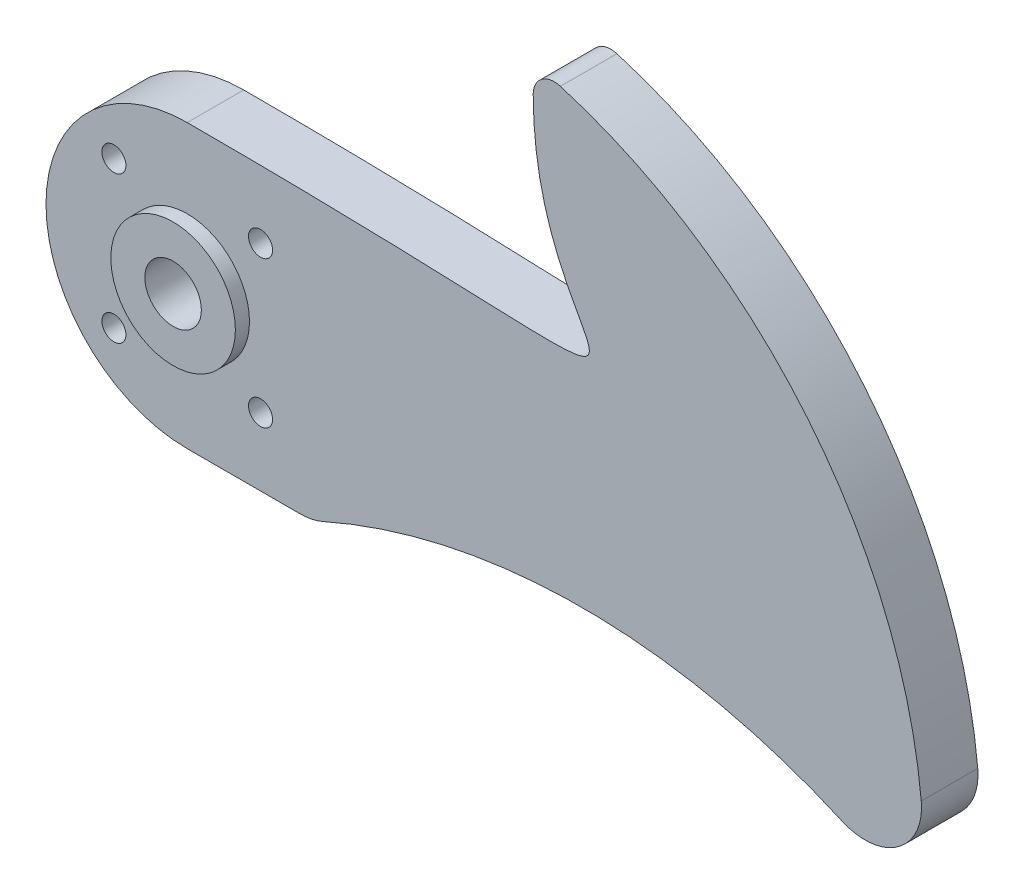
from build123d import *

# Parameters (mm, degrees)
SKETCH1_R             = 3.175
BOSS_EXTRUDE1_DEPTH   = 6.35
F_6_32_TAPPED_HOLE1_D = 2.7051
SKETCH4_R             = 7
SKETCH4_R_2           = 3.175
BOSS_EXTRUDE2_DEPTH   = 1.5875


with BuildPart() as part:
    # Sketch1 → Boss-Extrude1 (new body)
    with BuildSketch(Plane.XY):
        with BuildLine():
            Line((0, -15.875), (12.7, -15.875))
            ThreePointArc((12.7, -15.875), (14.017406742, -15.736838655), (15.277486023, -15.328366764))
            ThreePointArc((15.277486023, -15.328366764), (44.45, -9.14146), (73.622513977, -15.328366764))
            ThreePointArc((73.622513977, -15.328366764), (79.912012711, -14.677034708), (82.52084196, -8.917170323))
            ThreePointArc((82.52084196, -8.917170323), (69.763837113, 21.925102015), (41.955075464, 40.382071192))
            ThreePointArc((41.955075464, 40.382071192), (39.851813107, 40.009159666), (38.89375, 38.1))
            add(Edge.make_bspline(
                [(38.89375, 38.1), (38.89375, 8.240619939), (68.342560944, 15.875), (0, 15.875)],
                knots=[0, 0, 0, 0, 1, 1, 1, 1], degree=3))
            ThreePointArc((0, 15.875), (-15.875, 0), (0, -15.875))
        make_face()
        Circle(SKETCH1_R, mode=Mode.SUBTRACT)
    extrude(amount=BOSS_EXTRUDE1_DEPTH)

    # #6-32 Tapped Hole1 (through all)
    with Locations(Plane.XY.offset(6.35)):
        with Locations((8.242390195, 8.242390195), (-8.242390195, 8.242390195), (8.242390195, -8.242390195), (-8.242390195, -8.242390195)):
            Hole(F_6_32_TAPPED_HOLE1_D / 2)

    # Sketch4 → Boss-Extrude2 (add)
    with BuildSketch(Plane.XY.offset(6.35)):
        Circle(SKETCH4_R)
        Circle(SKETCH4_R_2, mode=Mode.SUBTRACT)
    extrude(amount=BOSS_EXTRUDE2_DEPTH)


solid = part.part
